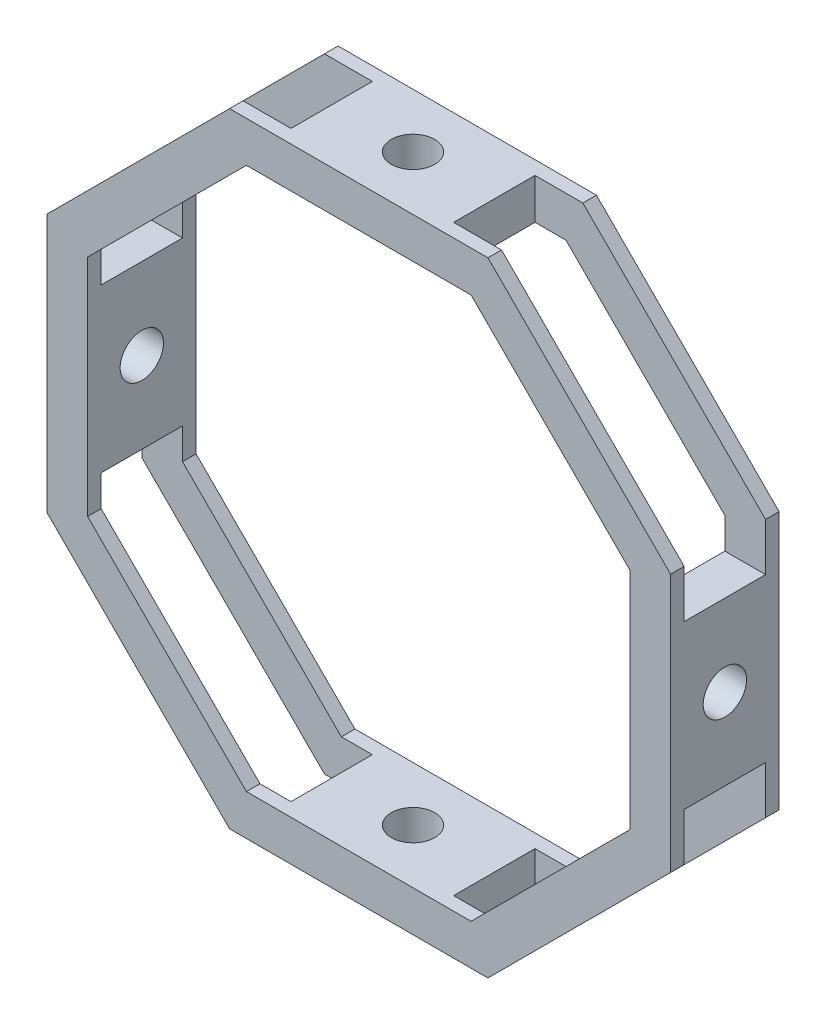
from build123d import *

# Parameters (mm, degrees)
RESSALTO_EXTRUS_O1_DEPTH   = 40
CORTE_EXTRUS_O1_DEPTH      = 261.240273593
CORTE_EXTRUS_O1_DEPTH_BACK = 261.240273593
ESBO_O2_R                  = 8
ESBO_O2_W                  = 30
ESBO_O2_H                  = 17.634559673
CORTE_EXTRUS_O2_DEPTH      = 261.240273593
CORTE_EXTRUS_O2_DEPTH_BACK = 261.240273593
ESBO_O3_R                  = 8
ESBO_O3_W                  = 17.634559673
ESBO_O3_H                  = 30
CORTE_EXTRUS_O3_DEPTH      = 281.501245496
CORTE_EXTRUS_O3_DEPTH_BACK = 281.501245496
ESBO_O4_W                  = 30
ESBO_O4_H                  = 95.269119346
CORTE_EXTRUS_O4_DEPTH      = 281.501245496
CORTE_EXTRUS_O4_DEPTH_BACK = 281.501245496
ESBO_O5_W                  = 30
ESBO_O5_H                  = 95.269119346


with BuildPart() as part:
    # Esboço1 → Ressalto-extrusão1 (new body)
    with BuildSketch(Plane.XY):
        Polygon((115, 47.634559673), (47.634559673, 115), (-47.634559673, 115), (-115, 47.634559673), (-115, -47.634559673), (-47.634559673, -115), (47.634559673, -115), (115, -47.634559673), align=None)
        Polygon((100, 41.421356237), (41.421356237, 100), (-41.421356237, 100), (-100, 41.421356237), (-100, -41.421356237), (-41.421356237, -100), (41.421356237, -100), (100, -41.421356237), align=None, mode=Mode.SUBTRACT)
    extrude(amount=RESSALTO_EXTRUS_O1_DEPTH)

    # Esboço2 → Corte-extrusão1 (cut, two sides: drawn at the far end of the back side and taken through both)
    with BuildSketch(Plane(origin=(115, 0, 0), x_dir=(0, 0, -1), z_dir=(1, 0, 0)).offset(-CORTE_EXTRUS_O1_DEPTH_BACK)):
        with Locations((-20, 0)):
            Circle(ESBO_O2_R)
        with Locations((-20, 38.817279837)):
            Rectangle(ESBO_O2_W, ESBO_O2_H)
        with Locations((-20, -38.817279837)):
            Rectangle(ESBO_O2_W, ESBO_O2_H)
    extrude(amount=CORTE_EXTRUS_O1_DEPTH + CORTE_EXTRUS_O1_DEPTH_BACK, mode=Mode.SUBTRACT)

    # Esboço3 → Corte-extrusão2 (cut, two sides: drawn at the far end of the back side and taken through both)
    with BuildSketch(Plane(origin=(0, 115, 0), x_dir=(1, 0, 0), z_dir=(0, 1, 0)).offset(-CORTE_EXTRUS_O2_DEPTH_BACK)):
        with Locations((0, -20)):
            Circle(ESBO_O3_R)
        with Locations((38.817279837, -20)):
            Rectangle(ESBO_O3_W, ESBO_O3_H)
        with Locations((-38.817279837, -20)):
            Rectangle(ESBO_O3_W, ESBO_O3_H)
    extrude(amount=CORTE_EXTRUS_O2_DEPTH + CORTE_EXTRUS_O2_DEPTH_BACK, mode=Mode.SUBTRACT)

    # Esboço4 → Corte-extrusão3 (cut, two sides: drawn at the far end of the back side and taken through both)
    with BuildSketch(Plane(origin=(81.317279836, 81.317279836, 0), x_dir=(0, 0, -1), z_dir=(0.7071067811865477, 0.7071067811865475, 0)).offset(-CORTE_EXTRUS_O3_DEPTH_BACK)):
        with Locations((-20, 0)):
            Rectangle(ESBO_O4_W, ESBO_O4_H)
    extrude(amount=CORTE_EXTRUS_O3_DEPTH + CORTE_EXTRUS_O3_DEPTH_BACK, mode=Mode.SUBTRACT)

    # Esboço5 → Corte-extrusão4 (cut, two sides: drawn at the far end of the back side and taken through both)
    with BuildSketch(Plane(origin=(-81.317279836, 81.317279836, 0), x_dir=(0, 0, 1), z_dir=(-0.7071067811865476, 0.7071067811865475, 0)).offset(-CORTE_EXTRUS_O4_DEPTH_BACK)):
        with Locations((20, 0)):
            Rectangle(ESBO_O5_W, ESBO_O5_H)
    extrude(amount=CORTE_EXTRUS_O4_DEPTH + CORTE_EXTRUS_O4_DEPTH_BACK, mode=Mode.SUBTRACT)


solid = part.part
